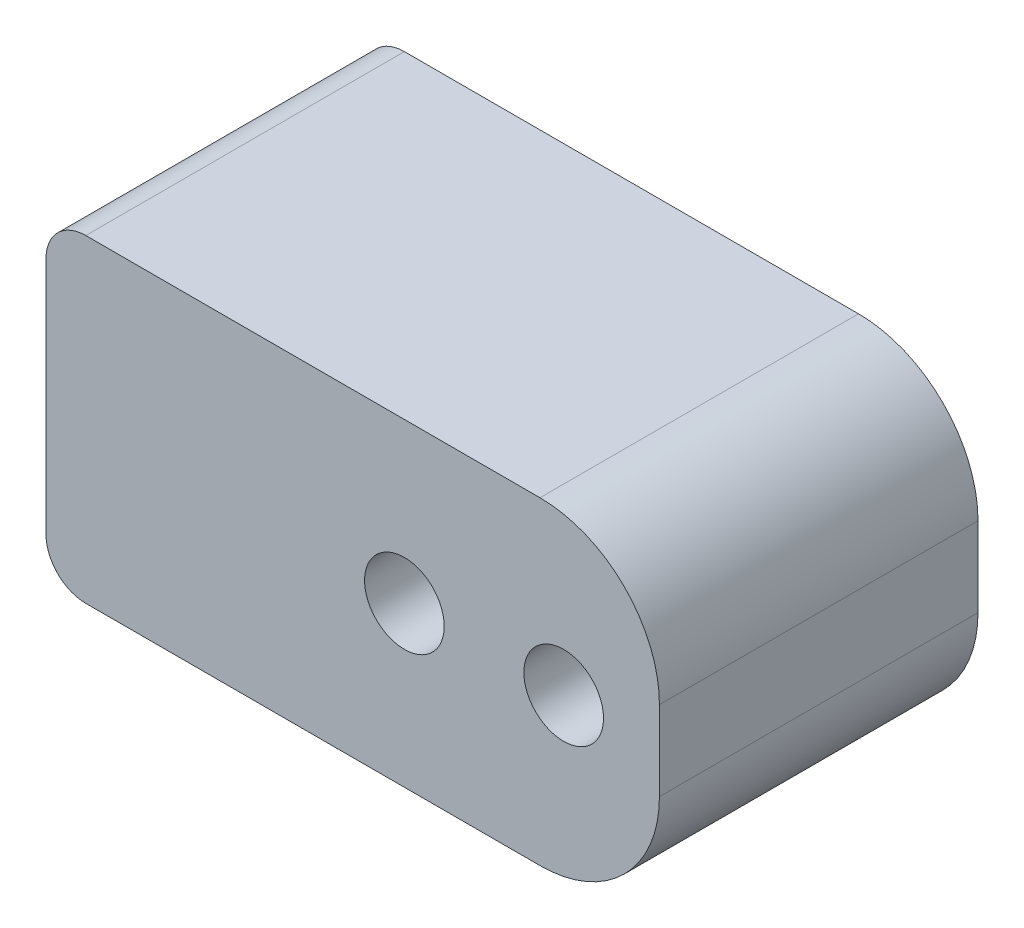
from build123d import *

# Parameters (mm, degrees)
SKETCH1_W           = 15.40451268
SKETCH1_H           = 8
SKETCH1_R           = 1
BOSS_EXTRUDE1_DEPTH = 8
SKETCH3_R           = 3.15
CUT_EXTRUDE2_DEPTH  = 1.15
FILLET2_R           = 1
FILLET3_R           = 3


with BuildPart() as part:
    # Sketch1 → Boss-Extrude1 (new body)
    with BuildSketch(Plane.XY):
        with Locations((-1.29774366, 0)):
            Rectangle(SKETCH1_W, SKETCH1_H)
        Circle(SKETCH1_R, mode=Mode.SUBTRACT)
        with Locations((4, 0)):
            Circle(SKETCH1_R, mode=Mode.SUBTRACT)
    extrude(amount=BOSS_EXTRUDE1_DEPTH)

    # Sketch3 → Cut-Extrude2 (cut, symmetric)
    with BuildSketch(Plane.XY.offset(4)):
        with Locations((-5, 0)):
            Circle(SKETCH3_R)
    extrude(amount=CUT_EXTRUDE2_DEPTH, both=True, mode=Mode.SUBTRACT)

    # Fillet2
    fillet2_edges = [part.edges().sort_by_distance(p)[0] for p in [
        (-9, -4, 4),
        (-9, 4, 4),
    ]]
    fillet(fillet2_edges, radius=FILLET2_R)

    # Fillet3
    fillet3_edges = [part.edges().sort_by_distance(p)[0] for p in [
        (6.40451268, -4, 4),
        (6.40451268, 4, 4),
    ]]
    fillet(fillet3_edges, radius=FILLET3_R)


solid = part.part
